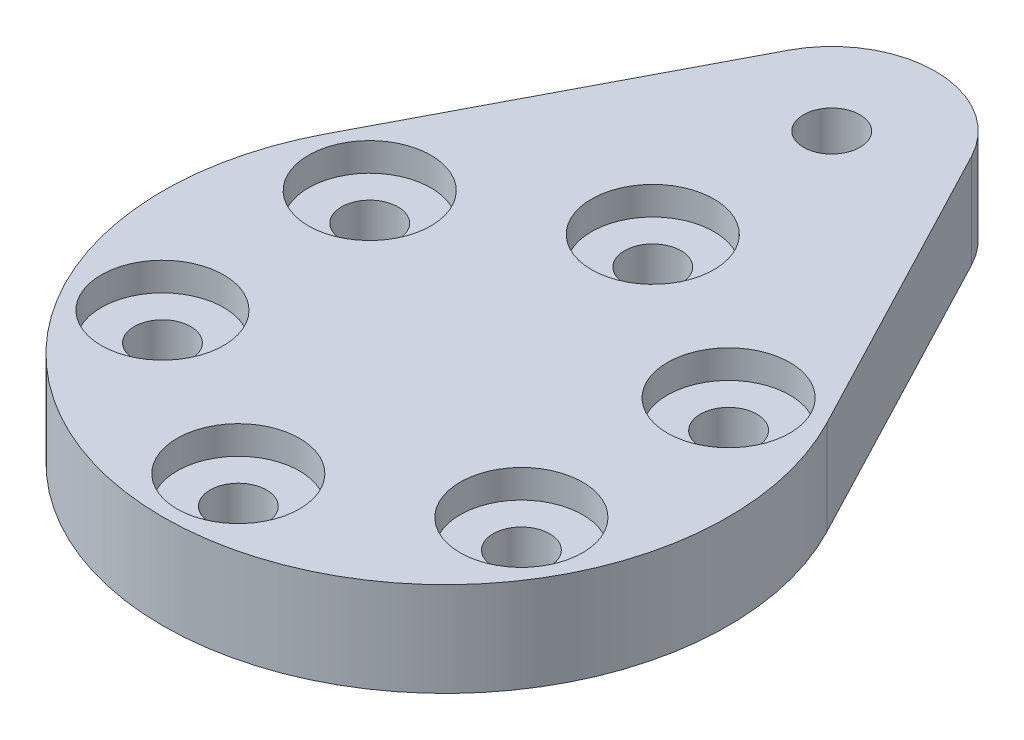
from build123d import *

# Parameters (mm, degrees)
SKETCH4_R           = 1.5
BOSS_EXTRUDE1_DEPTH = 5
SKETCH6_R           = 3.25
CUT_EXTRUDE1_DEPTH  = 1.5


with BuildPart() as part:
    # Sketch4 → Boss-Extrude1 (new body)
    with BuildSketch(Plane(origin=(0, 0, 0), x_dir=(1, 0, 0), z_dir=(0, 1, 0))):
        with BuildLine():
            Line((-4.873778619, 23.048780488), (-13.292123506, 6.951219512))
            ThreePointArc((-13.292123506, 6.951219512), (0, -15), (13.292123506, 6.951219512))
            Line((13.292123506, 6.951219512), (4.873778619, 23.048780488))
            ThreePointArc((4.873778619, 23.048780488), (0, 26), (-4.873778619, 23.048780488))
        make_face()
        with Locations((0, 20.5)):
            Circle(SKETCH4_R, mode=Mode.SUBTRACT)
        with Locations((9.526279442, 5.5)):
            Circle(SKETCH4_R, mode=Mode.SUBTRACT)
        with Locations((-9.526279442, -5.5)):
            Circle(SKETCH4_R, mode=Mode.SUBTRACT)
        with Locations((-9.526279442, 5.5)):
            Circle(SKETCH4_R, mode=Mode.SUBTRACT)
        with Locations((0, -11)):
            Circle(SKETCH4_R, mode=Mode.SUBTRACT)
        with Locations((9.526279442, -5.5)):
            Circle(SKETCH4_R, mode=Mode.SUBTRACT)
        with Locations((0, 11)):
            Circle(SKETCH4_R, mode=Mode.SUBTRACT)
    extrude(amount=BOSS_EXTRUDE1_DEPTH)

    # Sketch6 → Cut-Extrude1 (cut)
    with BuildSketch(Plane(origin=(0, 5, 0), x_dir=(1, 0, 0), z_dir=(0, 1, 0))):
        with Locations((0, 11)):
            Circle(SKETCH6_R)
        with Locations((9.526279442, 5.5)):
            Circle(SKETCH6_R)
        with Locations((9.526279442, -5.5)):
            Circle(SKETCH6_R)
        with Locations((0, -11)):
            Circle(SKETCH6_R)
        with Locations((-9.526279442, -5.5)):
            Circle(SKETCH6_R)
        with Locations((-9.526279442, 5.5)):
            Circle(SKETCH6_R)
    extrude(amount=-CUT_EXTRUDE1_DEPTH, mode=Mode.SUBTRACT)


solid = part.part
